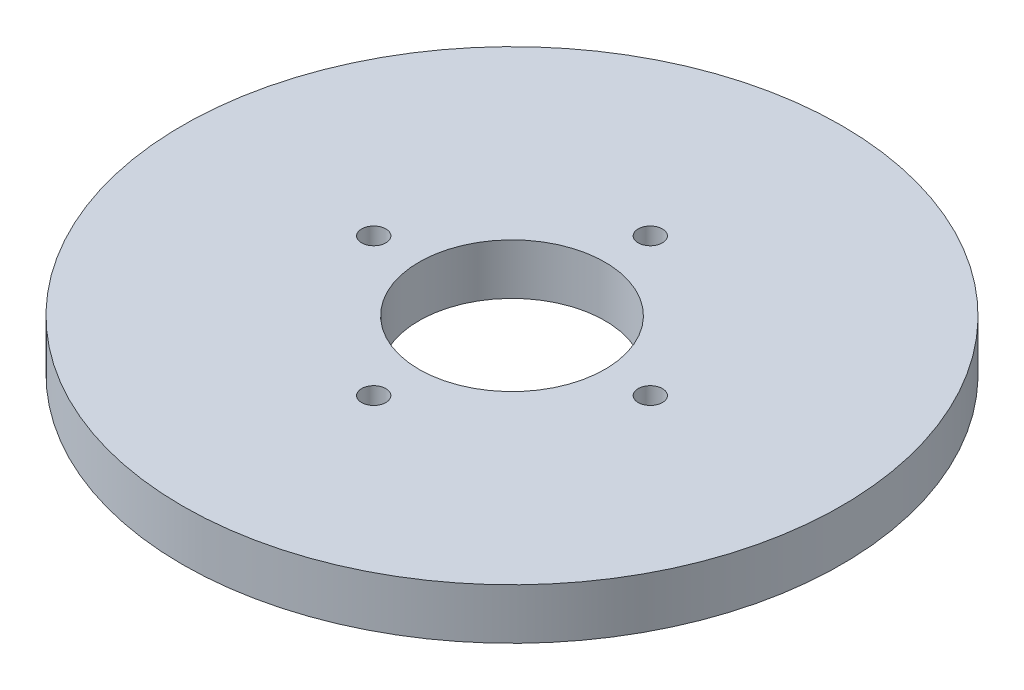
from build123d import *

# Parameters (mm, degrees)
SKETCH1_R           = 97.5
BOSS_EXTRUDE1_DEPTH = 15
SKETCH2_R           = 27.5
CUT_EXTRUDE1_DEPTH  = 139.699315067
SKETCH3_R           = 3.589640567
CUT_EXTRUDE2_DEPTH  = 9.646154374
CIRPATTERN1_COUNT   = 4


with BuildPart() as part:
    # Sketch1 → Boss-Extrude1 (new body)
    with BuildSketch(Plane(origin=(0, 0, 0), x_dir=(1, 0, 0), z_dir=(0, 1, 0))):
        Circle(SKETCH1_R)
    extrude(amount=BOSS_EXTRUDE1_DEPTH)

    # Sketch2 → Cut-Extrude1 (cut, through all)
    with BuildSketch(Plane(origin=(0, 0, 0), x_dir=(1, 0, 0), z_dir=(0, 1, 0))):
        Circle(SKETCH2_R)
    extrude(amount=CUT_EXTRUDE1_DEPTH, mode=Mode.SUBTRACT)

    # Sketch3 → Cut-Extrude2 (cut)
    with BuildSketch(Plane(origin=(0, 15, 0), x_dir=(1, 0, 0), z_dir=(0, 1, 0))):
        with Locations((-40.912084687, 0)):
            Circle(SKETCH3_R)
    cut_extrude2 = extrude(amount=-CUT_EXTRUDE2_DEPTH, mode=Mode.SUBTRACT)

    # CirPattern1: Cut-Extrude2 ×4 about axis
    cirpattern1_axis = Axis((0, 0, 0), (0, 1, 0))
    for i in range(1, CIRPATTERN1_COUNT):
        add(cut_extrude2.rotate(cirpattern1_axis, i * 360 / CIRPATTERN1_COUNT), mode=Mode.SUBTRACT)


solid = part.part
